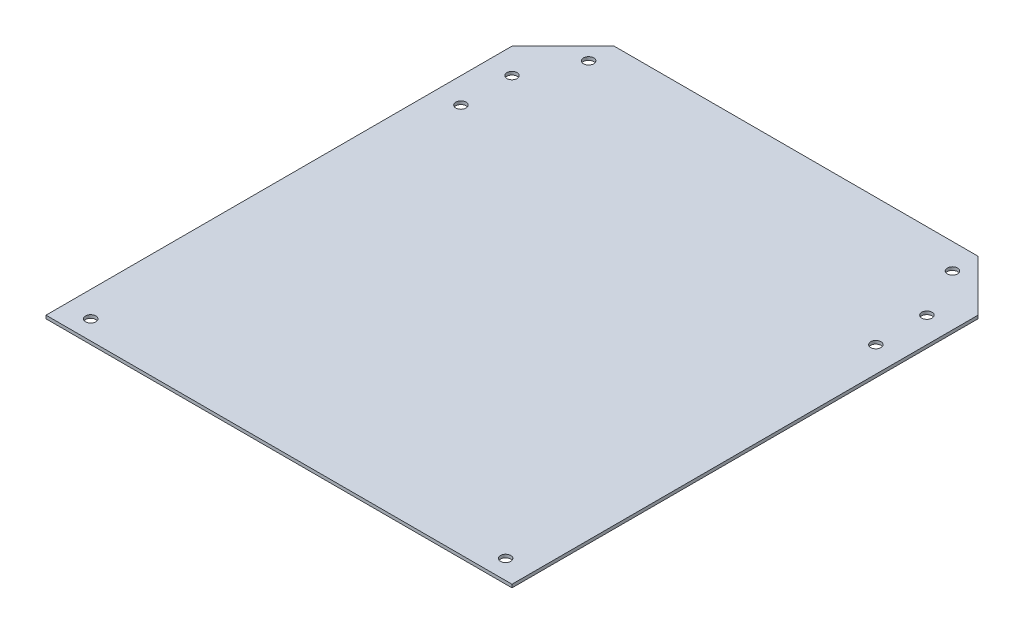
from build123d import *

# Parameters (mm, degrees)
BOSS_EXTRUDE1_DEPTH    = 1.5875
F_10_CLEARANCE_HOLE1_D = 5.1054


with BuildPart() as part:
    # Sketch3 → Boss-Extrude1 (new body)
    with BuildSketch(Plane(origin=(0, 0, 0), x_dir=(1, 0, 0), z_dir=(0, 1, 0))):
        Polygon((-96.156504661, 9.078464671), (135.618495843, 9.078464671), (135.618495843, 240.853464668), (110.218495881, 266.253464633), (-70.756504695, 266.253464633), (-96.156504661, 240.853464668), align=None)
    extrude(amount=BOSS_EXTRUDE1_DEPTH)

    # #10 Clearance Hole1 (through all)
    with Locations(Plane(origin=(0, 1.5875, 0), x_dir=(1, 0, 0), z_dir=(0, 1, 0))):
        with Locations((-83.456504661, -25.846534824), (-83.456504661, 202.753465684), (-83.456504661, 228.153465684), (-70.756504661, 253.553465684), (122.918495843, 202.753464668), (122.918495843, 228.153464668), (110.218495843, 253.553464668), (-83.456504661, 18.603465176), (122.918495843, 18.603465176)):
            Hole(F_10_CLEARANCE_HOLE1_D / 2)


solid = part.part
